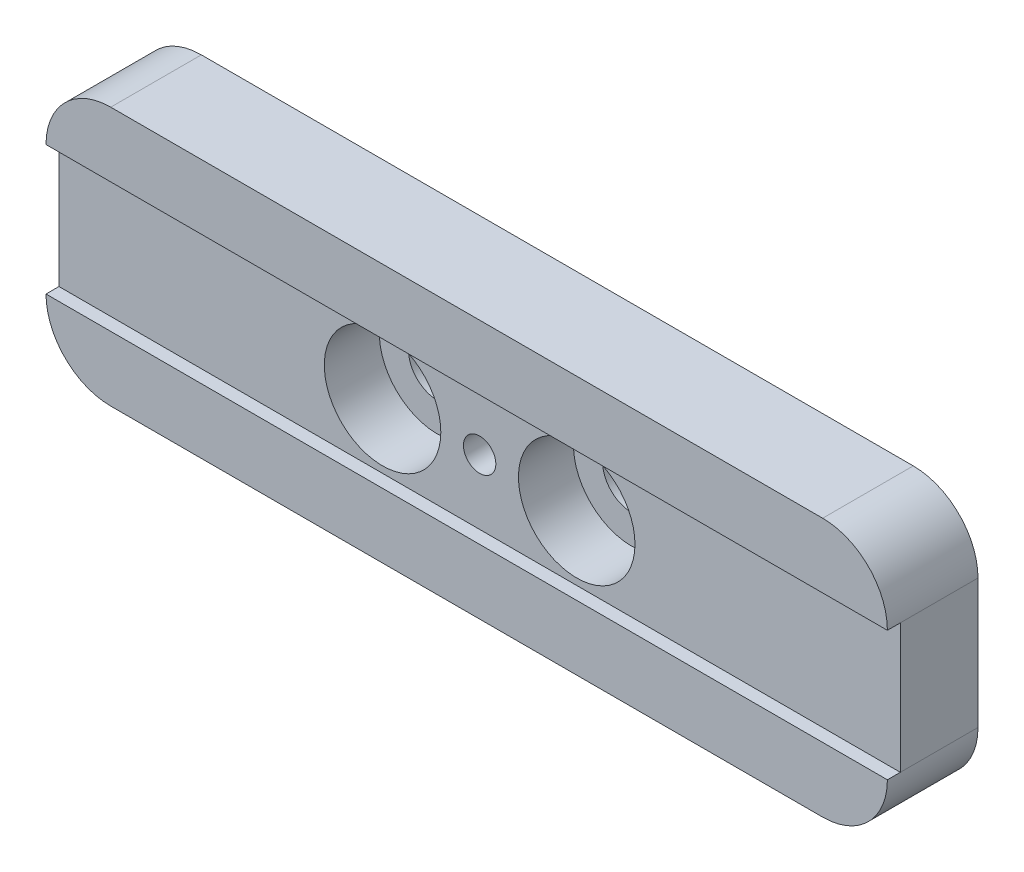
from build123d import *

# Parameters (mm, degrees)
SKETCH_1_W                   = 130
SKETCH_1_H                   = 40
EXTRUDE_1_DEPTH              = 14
HOLE_WIZARD_M6_1_D           = 5
SKETCH_8_W                   = 130
SKETCH_8_H                   = 20
CUT_EXTRUDE_1_DEPTH          = 2
HOLE_WIZARD_M8_1_D           = 9
HOLE_WIZARD_M8_1_CBORE_D     = 18
HOLE_WIZARD_M8_1_CBORE_DEPTH = 8.5
FILLET_1_R                   = 10


with BuildPart() as part:
    # 草图1 → 凸台-拉伸1 (new body)
    with BuildSketch(Plane.XY):
        with Locations((0, 20)):
            Rectangle(SKETCH_1_W, SKETCH_1_H)
    extrude(amount=EXTRUDE_1_DEPTH)

    # M6 螺纹孔1 (through all)
    with Locations(Plane.XY.offset(14)):
        with Locations((0, 20)):
            Hole(HOLE_WIZARD_M6_1_D / 2)

    # 草图8 → 切除-拉伸1 (cut)
    with BuildSketch(Plane.XY.offset(14)):
        with Locations((0, 20)):
            Rectangle(SKETCH_8_W, SKETCH_8_H)
    extrude(amount=-CUT_EXTRUDE_1_DEPTH, mode=Mode.SUBTRACT)

    # M8 六角头螺栓的柱形沉头孔1 (through all)
    with Locations(Plane.XY.offset(12)):
        with Locations((-15, 20), (15, 20)):
            CounterBoreHole(HOLE_WIZARD_M8_1_D / 2, HOLE_WIZARD_M8_1_CBORE_D / 2, HOLE_WIZARD_M8_1_CBORE_DEPTH)

    # 圆角1
    fillet_1_edges = [part.edges().sort_by_distance(p)[0] for p in [
        (65, 0, 7),
        (65, 40, 7),
        (-65, 0, 7),
        (-65, 40, 7),
    ]]
    fillet(fillet_1_edges, radius=FILLET_1_R - 0.0001)  # a hair under: the kernel refuses the full size


solid = part.part
